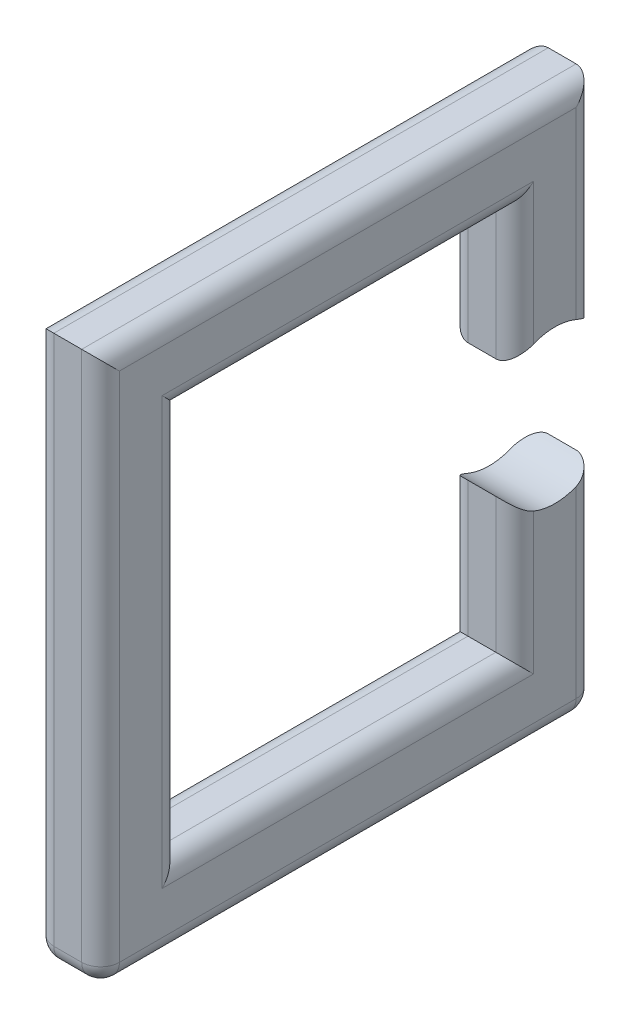
from build123d import *

# Parameters (mm, degrees)
BOSS_EXTRUDE1_DEPTH = 4.35
FILLET1_R           = 1.25
FILLET2_R           = 1.25


with BuildPart() as part:
    # Sketch1 → Boss-Extrude1 (new body)
    with BuildSketch(Plane(origin=(0, 0, 0), x_dir=(0, 0, -1), z_dir=(1, 0, 0))):
        with BuildLine():
            Line((-11.075, 12.91), (11.075, 12.91))
            Line((11.075, 12.91), (11.075, 3.951551724))
            ThreePointArc((11.075, 3.951551724), (13.74, 5.077445529), (16.405, 3.951551724))
            Line((16.405, 3.951551724), (16.405, 18.24))
            Line((16.405, 18.24), (-16.405, 18.24))
            Line((-16.405, 18.24), (-16.405, -18.24))
            Line((-16.405, -18.24), (16.405, -18.24))
            Line((16.405, -18.24), (16.405, -3.951551724))
            ThreePointArc((16.405, -3.951551724), (13.74, -5.077445529), (11.075, -3.951551724))
            Line((11.075, -3.951551724), (11.075, -12.91))
            Line((11.075, -12.91), (-11.075, -12.91))
            Line((-11.075, -12.91), (-11.075, 12.91))
        make_face()
    extrude(amount=BOSS_EXTRUDE1_DEPTH)

    # Fillet1
    fillet1_edges = [part.edges().sort_by_distance(p)[0] for p in [
        (4.35, 8.430775862, -11.075),
        (4.35, 11.095775862, -16.405),
        (4.35, 18.24, 0),
        (4.35, 0, 16.405),
        (4.35, -18.24, 0),
        (4.35, -11.095775862, -16.405),
        (4.35, -8.430775862, -11.075),
        (4.35, -12.91, 0),
        (4.35, 0, 11.075),
        (4.35, 12.91, 0),
    ]]
    fillet(fillet1_edges, radius=FILLET1_R)

    # Fillet2
    # the kernel refuses this fillet: 1.25 mm, written as the material it takes off along each edge
    with BuildSketch(Plane(origin=(3.1, -16.99, -15.155), x_dir=(0, -1, 0), z_dir=(0, 0, -1))) as fillet2_piece_1_section:
        Polygon((0, 0), (FILLET2_R, 0), (FILLET2_R, -FILLET2_R), (0, -FILLET2_R), align=None)
    fillet2_piece_1 = extrude(amount=FILLET2_R, mode=Mode.PRIVATE)
    fillet2_piece_1 = fillet2_piece_1 - Plane(origin=(3.1, -16.99, -15.155), x_dir=(-0.7071067811865475, 0.7071067811865475, 0), z_dir=(0, 0, -1)) * Sphere(FILLET2_R, mode=Mode.PRIVATE)
    add(fillet2_piece_1, mode=Mode.SUBTRACT)
    with BuildSketch(Plane(origin=(3.1, -16.99, 15.155), x_dir=(0, -1, 0), z_dir=(0, 0, 1))) as fillet2_piece_2_section:
        Polygon((0, 0), (FILLET2_R, 0), (FILLET2_R, FILLET2_R), (0, FILLET2_R), align=None)
    fillet2_piece_2 = extrude(amount=FILLET2_R, mode=Mode.PRIVATE)
    fillet2_piece_2 = fillet2_piece_2 - Plane(origin=(3.1, -16.99, 15.155), x_dir=(-0.7071067811865475, 0.7071067811865475, 0), z_dir=(0, 0, 1)) * Sphere(FILLET2_R, mode=Mode.PRIVATE)
    add(fillet2_piece_2, mode=Mode.SUBTRACT)
    with BuildSketch(Plane(origin=(1.25, -16.99, -15.155), x_dir=(-1, 0, 0), z_dir=(0, -1, 0))) as fillet2_piece_3_section:
        Polygon((0, 0), (FILLET2_R, 0), (FILLET2_R, FILLET2_R), (0, FILLET2_R), align=None)
    fillet2_piece_3 = extrude(amount=FILLET2_R, mode=Mode.PRIVATE)
    fillet2_piece_3 = fillet2_piece_3 - Plane(origin=(1.25, -16.99, -15.155), x_dir=(0.7071067811865475, 0, 0.7071067811865475), z_dir=(0, -1, 0)) * Sphere(FILLET2_R, mode=Mode.PRIVATE)
    add(fillet2_piece_3, mode=Mode.SUBTRACT)
    with BuildSketch(Plane(origin=(1.25, -16.99, 15.155), x_dir=(-1, 0, 0), z_dir=(0, -1, 0))) as fillet2_piece_4_section:
        Polygon((0, 0), (FILLET2_R, 0), (FILLET2_R, -FILLET2_R), (0, -FILLET2_R), align=None)
    fillet2_piece_4 = extrude(amount=FILLET2_R, mode=Mode.PRIVATE)
    fillet2_piece_4 = fillet2_piece_4 - Plane(origin=(1.25, -16.99, 15.155), x_dir=(0.7071067811865475, 0, -0.7071067811865475), z_dir=(0, -1, 0)) * Sphere(FILLET2_R, mode=Mode.PRIVATE)
    add(fillet2_piece_4, mode=Mode.SUBTRACT)
    with BuildSketch(Plane(origin=(0, -12.91, -11.075), x_dir=(0, -1, 0), z_dir=(0, 0, 1)), Plane(origin=(0, 12.91, 11.075), x_dir=(0, 1, 0), z_dir=(0, 0, -1))) as fillet2_piece_5:
        with BuildLine():
            CenterArc((FILLET2_R, FILLET2_R), FILLET2_R, 180, 90)
            Line((0, FILLET2_R), (0, 0))
            Line((0, 0), (FILLET2_R, 0))
        make_face()
    extrude(amount=22.15, mode=Mode.SUBTRACT)
    with BuildSketch(Plane(origin=(0, -0.826551724, -11.075), x_dir=(1, 0, 0), z_dir=(0, -1, 0))) as fillet2_piece_6:
        with BuildLine():
            CenterArc((FILLET2_R, -FILLET2_R), FILLET2_R, 90, 90)
            Line((0, -FILLET2_R), (0, 0))
            Line((0, 0), (FILLET2_R, 0))
        make_face()
    extrude(amount=12.083448276, mode=Mode.SUBTRACT)
    with BuildSketch(Plane(origin=(0, -16.99, -16.405), x_dir=(0, 0, 1), z_dir=(0, 1, 0))) as fillet2_piece_7:
        with BuildLine():
            CenterArc((FILLET2_R, FILLET2_R), FILLET2_R, 180, 90)
            Line((0, FILLET2_R), (0, 0))
            Line((0, 0), (FILLET2_R, 0))
        make_face()
    extrude(amount=16.163448276, mode=Mode.SUBTRACT)
    with BuildSketch(Plane(origin=(0, -18.24, 15.155), x_dir=(0, 1, 0), z_dir=(0, 0, -1))) as fillet2_piece_8:
        with BuildLine():
            CenterArc((FILLET2_R, FILLET2_R), FILLET2_R, 180, 90)
            Line((0, FILLET2_R), (0, 0))
            Line((0, 0), (FILLET2_R, 0))
        make_face()
    extrude(amount=30.31, mode=Mode.SUBTRACT)
    with BuildSketch(Plane(origin=(0, 21.365, 16.405), x_dir=(0, 0, -1), z_dir=(0, -1, 0))) as fillet2_piece_9:
        with BuildLine():
            CenterArc((FILLET2_R, FILLET2_R), FILLET2_R, 180, 90)
            Line((0, FILLET2_R), (0, 0))
            Line((0, 0), (FILLET2_R, 0))
        make_face()
    extrude(amount=38.355, mode=Mode.SUBTRACT)
    with BuildSketch(Plane(origin=(0, 18.24, -19.53), x_dir=(0, -1, 0), z_dir=(0, 0, 1))) as fillet2_piece_10:
        with BuildLine():
            CenterArc((FILLET2_R, FILLET2_R), FILLET2_R, 180, 90)
            Line((0, FILLET2_R), (0, 0))
            Line((0, 0), (FILLET2_R, 0))
        make_face()
    extrude(amount=39.06, mode=Mode.SUBTRACT)
    with BuildSketch(Plane(origin=(0, 0.826551724, -16.405), x_dir=(0, 0, 1), z_dir=(0, 1, 0))) as fillet2_piece_11:
        with BuildLine():
            CenterArc((FILLET2_R, FILLET2_R), FILLET2_R, 180, 90)
            Line((0, FILLET2_R), (0, 0))
            Line((0, 0), (FILLET2_R, 0))
        make_face()
    extrude(amount=20.538448276, mode=Mode.SUBTRACT)
    with BuildSketch(Plane(origin=(0, 12.91, -11.075), x_dir=(0, 0, -1), z_dir=(0, -1, 0))) as fillet2_piece_12:
        with BuildLine():
            CenterArc((FILLET2_R, FILLET2_R), FILLET2_R, 180, 90)
            Line((0, FILLET2_R), (0, 0))
            Line((0, 0), (FILLET2_R, 0))
        make_face()
    extrude(amount=12.083448276, mode=Mode.SUBTRACT)
    with BuildSketch(Plane(origin=(0, -12.91, 11.075), x_dir=(0, 0, 1), z_dir=(0, 1, 0))) as fillet2_piece_13:
        with BuildLine():
            CenterArc((FILLET2_R, FILLET2_R), FILLET2_R, 180, 90)
            Line((0, FILLET2_R), (0, 0))
            Line((0, 0), (FILLET2_R, 0))
        make_face()
    extrude(amount=25.82, mode=Mode.SUBTRACT)
    with BuildSketch(Plane(origin=(1.25, -18.24, 16.405), x_dir=(0, 1, 0), z_dir=(1, 0, 0))) as fillet2_piece_14:
        with BuildLine():
            CenterArc((FILLET2_R, -FILLET2_R), FILLET2_R, 90, 90)
            Line((0, -FILLET2_R), (0, 0))
            Line((0, 0), (FILLET2_R, 0))
        make_face()
    extrude(amount=1.85, mode=Mode.SUBTRACT)
    with BuildSketch(Plane(origin=(1.25, -18.24, -16.405), x_dir=(0, 1, 0), z_dir=(1, 0, 0))) as fillet2_piece_15:
        with BuildLine():
            CenterArc((FILLET2_R, FILLET2_R), FILLET2_R, 180, 90)
            Line((0, FILLET2_R), (0, 0))
            Line((0, 0), (FILLET2_R, 0))
        make_face()
    extrude(amount=1.85, mode=Mode.SUBTRACT)
    with BuildSketch(Plane(origin=(0, -0.826551724, -11.075), x_dir=(1, 0, 0), z_dir=(0, -1, 0))) as fillet2_piece_16a_section:
        with BuildLine():
            CenterArc((FILLET2_R, -FILLET2_R), FILLET2_R, 90, 90)
            Line((0, -FILLET2_R), (0, 0))
            Line((0, 0), (FILLET2_R, 0))
        make_face()
    fillet2_piece_16a = extrude(amount=15.208448276, mode=Mode.PRIVATE)
    fillet2_piece_16a = split(fillet2_piece_16a, bisect_by=Plane(origin=(0.282993893, -12.91, -11.357993893), z_dir=(0, -1, 0)), keep=Keep.TOP, mode=Mode.PRIVATE)
    with BuildSketch(Plane(origin=(0, -12.91, -14.2), x_dir=(0, -1, 0), z_dir=(0, 0, 1))) as fillet2_piece_16b_section:
        with BuildLine():
            CenterArc((FILLET2_R, FILLET2_R), FILLET2_R, 180, 90)
            Line((0, FILLET2_R), (0, 0))
            Line((0, 0), (FILLET2_R, 0))
        make_face()
    fillet2_piece_16b = extrude(amount=25.275, mode=Mode.PRIVATE)
    fillet2_piece_16b = split(fillet2_piece_16b, bisect_by=Plane(origin=(0.282993893, -13.192993893, -11.075), z_dir=(0, 0, -1)), keep=Keep.TOP, mode=Mode.PRIVATE)
    fillet2_piece_16 = fillet2_piece_16a & fillet2_piece_16b
    add(fillet2_piece_16, mode=Mode.SUBTRACT)
    with BuildSketch(Plane(origin=(0, -12.91, -11.075), x_dir=(0, -1, 0), z_dir=(0, 0, 1))) as fillet2_piece_17a_section:
        with BuildLine():
            CenterArc((FILLET2_R, FILLET2_R), FILLET2_R, 180, 90)
            Line((0, FILLET2_R), (0, 0))
            Line((0, 0), (FILLET2_R, 0))
        make_face()
    fillet2_piece_17a = extrude(amount=25.275, mode=Mode.PRIVATE)
    fillet2_piece_17a = split(fillet2_piece_17a, bisect_by=Plane(origin=(0.282993893, -13.192993893, 11.075), z_dir=(0, 0, 1)), keep=Keep.TOP, mode=Mode.PRIVATE)
    with BuildSketch(Plane(origin=(0, -16.035, 11.075), x_dir=(0, 0, 1), z_dir=(0, 1, 0))) as fillet2_piece_17b_section:
        with BuildLine():
            CenterArc((FILLET2_R, FILLET2_R), FILLET2_R, 180, 90)
            Line((0, FILLET2_R), (0, 0))
            Line((0, 0), (FILLET2_R, 0))
        make_face()
    fillet2_piece_17b = extrude(amount=28.945, mode=Mode.PRIVATE)
    fillet2_piece_17b = split(fillet2_piece_17b, bisect_by=Plane(origin=(0.282993893, -12.91, 11.357993893), z_dir=(0, -1, 0)), keep=Keep.TOP, mode=Mode.PRIVATE)
    fillet2_piece_17 = fillet2_piece_17a & fillet2_piece_17b
    add(fillet2_piece_17, mode=Mode.SUBTRACT)
    with BuildSketch(Plane(origin=(0, 12.91, 11.075), x_dir=(0, 1, 0), z_dir=(0, 0, -1))) as fillet2_piece_18a_section:
        with BuildLine():
            CenterArc((FILLET2_R, FILLET2_R), FILLET2_R, 180, 90)
            Line((0, FILLET2_R), (0, 0))
            Line((0, 0), (FILLET2_R, 0))
        make_face()
    fillet2_piece_18a = extrude(amount=25.275, mode=Mode.PRIVATE)
    fillet2_piece_18a = split(fillet2_piece_18a, bisect_by=Plane(origin=(0.282993893, 13.192993893, -11.075), z_dir=(0, 0, -1)), keep=Keep.TOP, mode=Mode.PRIVATE)
    with BuildSketch(Plane(origin=(0, 16.035, -11.075), x_dir=(0, 0, -1), z_dir=(0, -1, 0))) as fillet2_piece_18b_section:
        with BuildLine():
            CenterArc((FILLET2_R, FILLET2_R), FILLET2_R, 180, 90)
            Line((0, FILLET2_R), (0, 0))
            Line((0, 0), (FILLET2_R, 0))
        make_face()
    fillet2_piece_18b = extrude(amount=15.208448276, mode=Mode.PRIVATE)
    fillet2_piece_18b = split(fillet2_piece_18b, bisect_by=Plane(origin=(0.282993893, 12.91, -11.357993893), z_dir=(0, 1, 0)), keep=Keep.TOP, mode=Mode.PRIVATE)
    fillet2_piece_18 = fillet2_piece_18a & fillet2_piece_18b
    add(fillet2_piece_18, mode=Mode.SUBTRACT)
    with BuildSketch(Plane(origin=(0, -12.91, 11.075), x_dir=(0, 0, 1), z_dir=(0, 1, 0))) as fillet2_piece_19a_section:
        with BuildLine():
            CenterArc((FILLET2_R, FILLET2_R), FILLET2_R, 180, 90)
            Line((0, FILLET2_R), (0, 0))
            Line((0, 0), (FILLET2_R, 0))
        make_face()
    fillet2_piece_19a = extrude(amount=28.945, mode=Mode.PRIVATE)
    fillet2_piece_19a = split(fillet2_piece_19a, bisect_by=Plane(origin=(0.282993893, 12.91, 11.357993893), z_dir=(0, 1, 0)), keep=Keep.TOP, mode=Mode.PRIVATE)
    with BuildSketch(Plane(origin=(0, 12.91, 14.2), x_dir=(0, 1, 0), z_dir=(0, 0, -1))) as fillet2_piece_19b_section:
        with BuildLine():
            CenterArc((FILLET2_R, FILLET2_R), FILLET2_R, 180, 90)
            Line((0, FILLET2_R), (0, 0))
            Line((0, 0), (FILLET2_R, 0))
        make_face()
    fillet2_piece_19b = extrude(amount=25.275, mode=Mode.PRIVATE)
    fillet2_piece_19b = split(fillet2_piece_19b, bisect_by=Plane(origin=(0.282993893, 13.192993893, 11.075), z_dir=(0, 0, 1)), keep=Keep.TOP, mode=Mode.PRIVATE)
    fillet2_piece_19 = fillet2_piece_19a & fillet2_piece_19b
    add(fillet2_piece_19, mode=Mode.SUBTRACT)


solid = part.part
